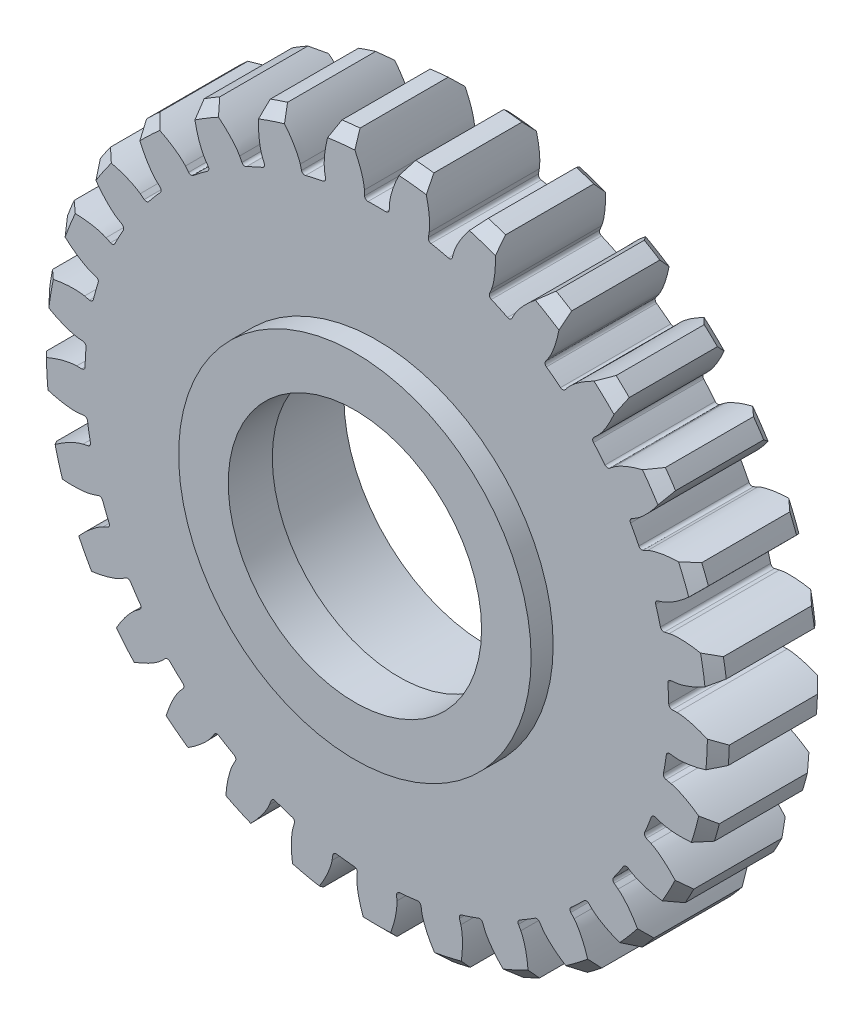
from build123d import *

# Parameters (mm, degrees)
SKETCH_1138_R                    = 31
EXTRUDE_1164_DEPTH               = 5
CHAMFER_1203_SIZE                = 1
CUT_EXTRUDE_1599_DEPTH           = 5
FILLET_2_R                       = 0.3
PATTERN_CIRCULAR_2_COUNT         = 29
FILLET_2_OF_PATTERN_CIRCULAR_2_R = 0.3
SKETCH_1_R                       = 16
EXTRUDE_1_DEPTH                  = 2
SKETCH_2_R                       = 11.5
CUT_EXTRUDE_1_DEPTH              = 46.445221355
SKETCH_3_R                       = 13
CUT_EXTRUDE_2_DEPTH              = 8


with BuildPart() as part:
    # Sketch 1138 → Extrude 1164 (new, symmetric)
    with BuildSketch(Plane.XY):
        Circle(SKETCH_1138_R)
    extrude(amount=EXTRUDE_1164_DEPTH, both=True)

    # Chamfer 1203
    chamfer_1203_edges = [part.edges().sort_by_distance(p)[0] for p in [
        (-31, 0, -5),
        (-31, 0, 5),
    ]]
    chamfer(chamfer_1203_edges, length=CHAMFER_1203_SIZE)

    # Sketch 1284 → Cut-Extrude 1599 (cut, symmetric)
    with BuildSketch(Plane.XY):
        with BuildLine():
            ThreePointArc((-1.104786538, 26.476960677), (0, 26.5), (1.104786538, 26.476960677))
            Line((1.104786538, 26.476960677), (1.136099357, 27.22739368))
            add(Edge.make_bspline(
                [(1.136099357, 27.22739368), (1.138260942, 27.27919754), (1.1457739, 27.382529804), (1.173487082, 27.588092333), (1.231861274, 27.883292962), (1.317005584, 28.215206021), (1.45921023, 28.671361206), (1.683527934, 29.268434178), (1.969814442, 29.895411514), (2.250869211, 30.420381815), (2.457132384, 30.772524979), (2.531906783, 30.896430992)],
                knots=[0, 0, 0, 0, 0, 0.001401017, 0.002802034, 0.005604068, 0.008132613, 0.010661158, 0.015718248, 0.022839082, 0.026752354, 0.026752354, 0.026752354, 0.026752354, 0.026752354], degree=4))
            ThreePointArc((2.531906783, 30.896430992), (0, 31), (-2.531906783, 30.896430992))
            add(Edge.make_bspline(
                [(-1.136099357, 27.22739368), (-1.138260942, 27.27919754), (-1.1457739, 27.382529804), (-1.173487082, 27.588092333), (-1.231861274, 27.883292962), (-1.317005584, 28.215206021), (-1.45921023, 28.671361206), (-1.683527934, 29.268434178), (-1.969814442, 29.895411514), (-2.250869211, 30.420381815), (-2.457132384, 30.772524979), (-2.531906783, 30.896430992)],
                knots=[0, 0, 0, 0, 0, 0.001401017, 0.002802034, 0.005604068, 0.008132613, 0.010661158, 0.015718248, 0.022839082, 0.026752354, 0.026752354, 0.026752354, 0.026752354, 0.026752354], degree=4))
            Line((-1.136099357, 27.22739368), (-1.104786538, 26.476960677))
        make_face()
    cut_extrude_1599 = extrude(amount=CUT_EXTRUDE_1599_DEPTH, both=True, mode=Mode.SUBTRACT)

    # 圆角2
    fillet_2_edges = [part.edges().sort_by_distance(p)[0] for p in [
        (1.104786538, 26.476960677, 0),
        (-1.104786538, 26.476960677, 0),
    ]]
    fillet(fillet_2_edges, radius=FILLET_2_R)

    # 圆周阵列2: Cut-Extrude 1599 ×29 about axis
    pattern_circular_2_axis = Axis((0, 0, 5), (0, 0, -1))
    for i in range(1, PATTERN_CIRCULAR_2_COUNT):
        add(cut_extrude_1599.rotate(pattern_circular_2_axis, i * 360 / PATTERN_CIRCULAR_2_COUNT), mode=Mode.SUBTRACT)

    # 圆角2 of 圆周阵列2
    fillet_2_of_pattern_circular_2_edges = [part.edges().sort_by_distance(p)[0] for p in [
        (6.770721135, 25.620447602, 0),
        (4.61280665, 26.095440499, 0),
        (12.120064337, 23.565950871, 0),
        (10.114710125, 24.493726525, 0),
        (16.9026868, 20.40953647, 0),
        (15.143660997, 21.746713122, 0),
        (20.894958416, 16.298794827, 0),
        (19.464511111, 17.982847583, 0),
        (23.910204998, 11.425939653, 0),
        (22.875222319, 13.378124078, 0),
        (25.807436969, 6.018820239, 0),
        (25.216313556, 8.14785436, 0),
        (26.497941871, 0.33026748, 0),
        (26.378317996, 2.536600027, 0),
        (25.949432461, -5.373728218, 0),
        (26.306901604, -3.193262904, 0),
        (24.18755643, -10.826454358, 0),
        (25.005403732, -8.77381241, 0),
        (21.294697142, -15.772947525, 0),
        (22.534680972, -13.944108199, 0),
        (17.406121484, -19.981915196, 0),
        (19.010261576, -18.462392987, 0),
        (12.70365493, -23.25655072, 0),
        (14.596943477, -22.117396798, 0),
        (7.407179591, -25.443735781, 0),
        (9.501088524, -24.738215717, 0),
        (1.764352767, -26.441200035, 0),
        (3.960973231, -26.202303163, 0),
        (-3.960973231, -26.202303163, 0),
        (-1.764352767, -26.441200035, 0),
        (-9.501088524, -24.738215717, 0),
        (-7.407179591, -25.443735781, 0),
        (-14.596943477, -22.117396798, 0),
        (-12.70365493, -23.25655072, 0),
        (-19.010261576, -18.462392987, 0),
        (-17.406121484, -19.981915196, 0),
        (-22.534680972, -13.944108199, 0),
        (-21.294697142, -15.772947525, 0),
        (-25.005403732, -8.77381241, 0),
        (-24.18755643, -10.826454358, 0),
        (-26.306901604, -3.193262904, 0),
        (-25.949432461, -5.373728218, 0),
        (-26.378317996, 2.536600027, 0),
        (-26.497941871, 0.33026748, 0),
        (-25.216313556, 8.14785436, 0),
        (-25.807436969, 6.018820239, 0),
        (-22.875222319, 13.378124078, 0),
        (-23.910204998, 11.425939653, 0),
        (-19.464511111, 17.982847583, 0),
        (-20.894958416, 16.298794827, 0),
        (-15.143660997, 21.746713122, 0),
        (-16.9026868, 20.40953647, 0),
        (-10.114710125, 24.493726525, 0),
        (-12.120064337, 23.565950871, 0),
        (-4.61280665, 26.095440499, 0),
        (-6.770721135, 25.620447602, 0),
    ]]
    fillet(fillet_2_of_pattern_circular_2_edges, radius=FILLET_2_OF_PATTERN_CIRCULAR_2_R)

    # 草图1 → 凸台-拉伸1 (add)
    with BuildSketch(Plane.XY.offset(5)):
        Circle(SKETCH_1_R)
    extrude(amount=EXTRUDE_1_DEPTH)

    # 草图2 → 切除-拉伸1 (cut, through all)
    with BuildSketch(Plane.XY.offset(7)):
        Circle(SKETCH_2_R)
    extrude(amount=-CUT_EXTRUDE_1_DEPTH, mode=Mode.SUBTRACT)

    # 草图3 → 切除-拉伸2 (cut)
    with BuildSketch(Plane(origin=(0, 0, -5), x_dir=(-1, 0, 0), z_dir=(0, 0, -1))):
        Circle(SKETCH_3_R)
    extrude(amount=-CUT_EXTRUDE_2_DEPTH, mode=Mode.SUBTRACT)


solid = part.part
